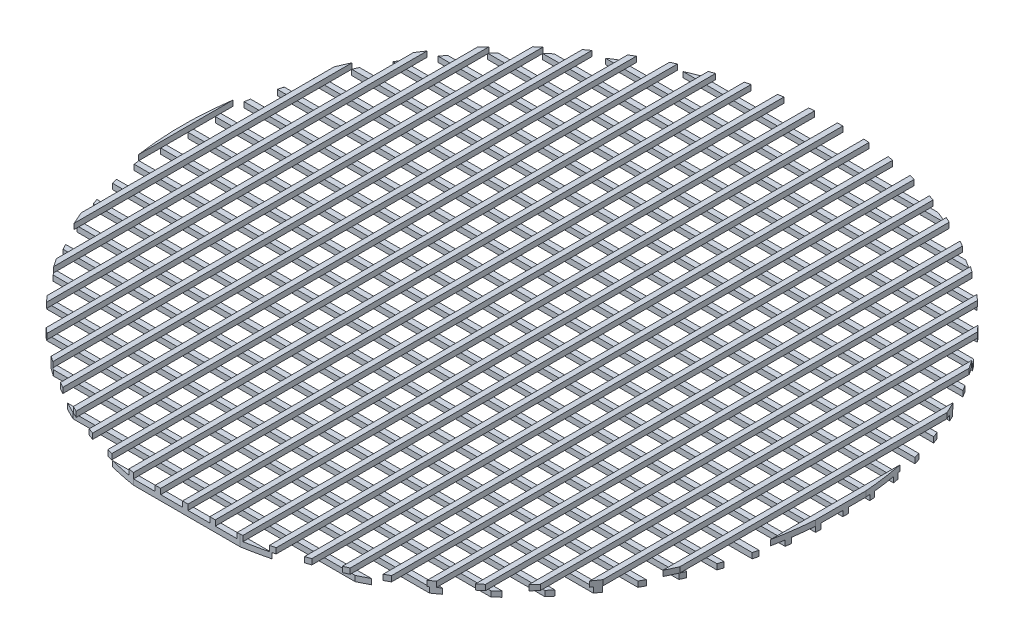
from build123d import *

# Parameters (mm, degrees)
SKETCH1_W              = 0.1
SKETCH1_H              = 12
BOSS_EXTRUDE2_DEPTH    = 0.1
BOSS_EXTRUDE2_2_DEPTH  = 0.1
BOSS_EXTRUDE2_3_DEPTH  = 0.1
BOSS_EXTRUDE2_4_DEPTH  = 0.1
BOSS_EXTRUDE2_5_DEPTH  = 0.1
BOSS_EXTRUDE2_6_DEPTH  = 0.1
BOSS_EXTRUDE2_7_DEPTH  = 0.1
BOSS_EXTRUDE2_8_DEPTH  = 0.1
BOSS_EXTRUDE2_9_DEPTH  = 0.1
BOSS_EXTRUDE2_10_DEPTH = 0.1
BOSS_EXTRUDE2_11_DEPTH = 0.1
BOSS_EXTRUDE2_12_DEPTH = 0.1
BOSS_EXTRUDE2_13_DEPTH = 0.1
BOSS_EXTRUDE2_14_DEPTH = 0.1
BOSS_EXTRUDE2_15_DEPTH = 0.1
BOSS_EXTRUDE2_16_DEPTH = 0.1
BOSS_EXTRUDE2_17_DEPTH = 0.1
BOSS_EXTRUDE2_18_DEPTH = 0.1
BOSS_EXTRUDE2_19_DEPTH = 0.1
BOSS_EXTRUDE2_20_DEPTH = 0.1
BOSS_EXTRUDE2_21_DEPTH = 0.1
BOSS_EXTRUDE2_22_DEPTH = 0.1
BOSS_EXTRUDE2_23_DEPTH = 0.1
BOSS_EXTRUDE2_24_DEPTH = 0.1
BOSS_EXTRUDE2_25_DEPTH = 0.1
SKETCH3_W              = 12
SKETCH3_H              = 0.1
BOSS_EXTRUDE5_DEPTH    = 0.1
SKETCH4_OUTSIDE_W      = 17.522
SKETCH4_OUTSIDE_H      = 17.522
SKETCH4_OUTSIDE_R      = 6.039831041
CUT_EXTRUDE2_DEPTH     = 53.029315831
SKETCH4_2_OUTSIDE_W    = 17.508
SKETCH4_2_OUTSIDE_H    = 17.408
SKETCH4_2_OUTSIDE_R    = 6.039831041
CUT_EXTRUDE4_DEPTH     = 52.966682012


with BuildPart() as part:
    # Sketch1 → Boss-Extrude2 (new body)
    with BuildSketch(Plane(origin=(0, 0, 0), x_dir=(1, 0, 0), z_dir=(0, 1, 0))):
        with Locations((-33.984973502, 26.518332714)):
            Rectangle(SKETCH1_W, SKETCH1_H)
    extrude(amount=BOSS_EXTRUDE2_DEPTH)


with BuildPart() as body_2:
    # Sketch1 → Boss-Extrude2 2 (new body)
    with BuildSketch(Plane(origin=(0, 0, 0), x_dir=(1, 0, 0), z_dir=(0, 1, 0))):
        with Locations((-34.484973502, 26.518332714)):
            Rectangle(SKETCH1_W, SKETCH1_H)
    extrude(amount=BOSS_EXTRUDE2_2_DEPTH)


    add(part.part)  # Boss-Extrude5 merges part


with BuildPart() as body_3:
    # Sketch1 → Boss-Extrude2 3 (new body)
    with BuildSketch(Plane(origin=(0, 0, 0), x_dir=(1, 0, 0), z_dir=(0, 1, 0))):
        with Locations((-33.484973502, 26.518332714)):
            Rectangle(SKETCH1_W, SKETCH1_H)
    extrude(amount=BOSS_EXTRUDE2_3_DEPTH)


with BuildPart() as body_4:
    # Sketch1 → Boss-Extrude2 4 (new body)
    with BuildSketch(Plane(origin=(0, 0, 0), x_dir=(1, 0, 0), z_dir=(0, 1, 0))):
        with Locations((-32.984973502, 26.518332714)):
            Rectangle(SKETCH1_W, SKETCH1_H)
    extrude(amount=BOSS_EXTRUDE2_4_DEPTH)


with BuildPart() as body_5:
    # Sketch1 → Boss-Extrude2 5 (new body)
    with BuildSketch(Plane(origin=(0, 0, 0), x_dir=(1, 0, 0), z_dir=(0, 1, 0))):
        with Locations((-32.484973502, 26.518332714)):
            Rectangle(SKETCH1_W, SKETCH1_H)
    extrude(amount=BOSS_EXTRUDE2_5_DEPTH)


with BuildPart() as body_6:
    # Sketch1 → Boss-Extrude2 6 (new body)
    with BuildSketch(Plane(origin=(0, 0, 0), x_dir=(1, 0, 0), z_dir=(0, 1, 0))):
        with Locations((-31.984973502, 26.518332714)):
            Rectangle(SKETCH1_W, SKETCH1_H)
    extrude(amount=BOSS_EXTRUDE2_6_DEPTH)


with BuildPart() as body_7:
    # Sketch1 → Boss-Extrude2 7 (new body)
    with BuildSketch(Plane(origin=(0, 0, 0), x_dir=(1, 0, 0), z_dir=(0, 1, 0))):
        with Locations((-31.484973502, 26.518332714)):
            Rectangle(SKETCH1_W, SKETCH1_H)
    extrude(amount=BOSS_EXTRUDE2_7_DEPTH)


with BuildPart() as body_8:
    # Sketch1 → Boss-Extrude2 8 (new body)
    with BuildSketch(Plane(origin=(0, 0, 0), x_dir=(1, 0, 0), z_dir=(0, 1, 0))):
        with Locations((-30.984973502, 26.518332714)):
            Rectangle(SKETCH1_W, SKETCH1_H)
    extrude(amount=BOSS_EXTRUDE2_8_DEPTH)


with BuildPart() as body_9:
    # Sketch1 → Boss-Extrude2 9 (new body)
    with BuildSketch(Plane(origin=(0, 0, 0), x_dir=(1, 0, 0), z_dir=(0, 1, 0))):
        with Locations((-30.484973502, 26.518332714)):
            Rectangle(SKETCH1_W, SKETCH1_H)
    extrude(amount=BOSS_EXTRUDE2_9_DEPTH)


with BuildPart() as body_10:
    # Sketch1 → Boss-Extrude2 10 (new body)
    with BuildSketch(Plane(origin=(0, 0, 0), x_dir=(1, 0, 0), z_dir=(0, 1, 0))):
        with Locations((-29.984973502, 26.518332714)):
            Rectangle(SKETCH1_W, SKETCH1_H)
    extrude(amount=BOSS_EXTRUDE2_10_DEPTH)


with BuildPart() as body_11:
    # Sketch1 → Boss-Extrude2 11 (new body)
    with BuildSketch(Plane(origin=(0, 0, 0), x_dir=(1, 0, 0), z_dir=(0, 1, 0))):
        with Locations((-29.484973502, 26.518332714)):
            Rectangle(SKETCH1_W, SKETCH1_H)
    extrude(amount=BOSS_EXTRUDE2_11_DEPTH)


with BuildPart() as body_12:
    # Sketch1 → Boss-Extrude2 12 (new body)
    with BuildSketch(Plane(origin=(0, 0, 0), x_dir=(1, 0, 0), z_dir=(0, 1, 0))):
        with Locations((-28.984973502, 26.518332714)):
            Rectangle(SKETCH1_W, SKETCH1_H)
    extrude(amount=BOSS_EXTRUDE2_12_DEPTH)


with BuildPart() as body_13:
    # Sketch1 → Boss-Extrude2 13 (new body)
    with BuildSketch(Plane(origin=(0, 0, 0), x_dir=(1, 0, 0), z_dir=(0, 1, 0))):
        with Locations((-28.484973502, 26.518332714)):
            Rectangle(SKETCH1_W, SKETCH1_H)
    extrude(amount=BOSS_EXTRUDE2_13_DEPTH)


with BuildPart() as body_14:
    # Sketch1 → Boss-Extrude2 14 (new body)
    with BuildSketch(Plane(origin=(0, 0, 0), x_dir=(1, 0, 0), z_dir=(0, 1, 0))):
        with Locations((-34.984973502, 26.518332714)):
            Rectangle(SKETCH1_W, SKETCH1_H)
    extrude(amount=BOSS_EXTRUDE2_14_DEPTH)


with BuildPart() as body_15:
    # Sketch1 → Boss-Extrude2 15 (new body)
    with BuildSketch(Plane(origin=(0, 0, 0), x_dir=(1, 0, 0), z_dir=(0, 1, 0))):
        with Locations((-35.484973502, 26.518332714)):
            Rectangle(SKETCH1_W, SKETCH1_H)
    extrude(amount=BOSS_EXTRUDE2_15_DEPTH)


with BuildPart() as body_16:
    # Sketch1 → Boss-Extrude2 16 (new body)
    with BuildSketch(Plane(origin=(0, 0, 0), x_dir=(1, 0, 0), z_dir=(0, 1, 0))):
        with Locations((-35.984973502, 26.518332714)):
            Rectangle(SKETCH1_W, SKETCH1_H)
    extrude(amount=BOSS_EXTRUDE2_16_DEPTH)


with BuildPart() as body_17:
    # Sketch1 → Boss-Extrude2 17 (new body)
    with BuildSketch(Plane(origin=(0, 0, 0), x_dir=(1, 0, 0), z_dir=(0, 1, 0))):
        with Locations((-36.484973502, 26.518332714)):
            Rectangle(SKETCH1_W, SKETCH1_H)
    extrude(amount=BOSS_EXTRUDE2_17_DEPTH)


with BuildPart() as body_18:
    # Sketch1 → Boss-Extrude2 18 (new body)
    with BuildSketch(Plane(origin=(0, 0, 0), x_dir=(1, 0, 0), z_dir=(0, 1, 0))):
        with Locations((-36.984973502, 26.518332714)):
            Rectangle(SKETCH1_W, SKETCH1_H)
    extrude(amount=BOSS_EXTRUDE2_18_DEPTH)


with BuildPart() as body_19:
    # Sketch1 → Boss-Extrude2 19 (new body)
    with BuildSketch(Plane(origin=(0, 0, 0), x_dir=(1, 0, 0), z_dir=(0, 1, 0))):
        with Locations((-37.484973502, 26.518332714)):
            Rectangle(SKETCH1_W, SKETCH1_H)
    extrude(amount=BOSS_EXTRUDE2_19_DEPTH)


with BuildPart() as body_20:
    # Sketch1 → Boss-Extrude2 20 (new body)
    with BuildSketch(Plane(origin=(0, 0, 0), x_dir=(1, 0, 0), z_dir=(0, 1, 0))):
        with Locations((-37.984973502, 26.518332714)):
            Rectangle(SKETCH1_W, SKETCH1_H)
    extrude(amount=BOSS_EXTRUDE2_20_DEPTH)


with BuildPart() as body_21:
    # Sketch1 → Boss-Extrude2 21 (new body)
    with BuildSketch(Plane(origin=(0, 0, 0), x_dir=(1, 0, 0), z_dir=(0, 1, 0))):
        with Locations((-38.484973502, 26.518332714)):
            Rectangle(SKETCH1_W, SKETCH1_H)
    extrude(amount=BOSS_EXTRUDE2_21_DEPTH)


with BuildPart() as body_22:
    # Sketch1 → Boss-Extrude2 22 (new body)
    with BuildSketch(Plane(origin=(0, 0, 0), x_dir=(1, 0, 0), z_dir=(0, 1, 0))):
        with Locations((-38.984973502, 26.518332714)):
            Rectangle(SKETCH1_W, SKETCH1_H)
    extrude(amount=BOSS_EXTRUDE2_22_DEPTH)


with BuildPart() as body_23:
    # Sketch1 → Boss-Extrude2 23 (new body)
    with BuildSketch(Plane(origin=(0, 0, 0), x_dir=(1, 0, 0), z_dir=(0, 1, 0))):
        with Locations((-39.484973502, 26.518332714)):
            Rectangle(SKETCH1_W, SKETCH1_H)
    extrude(amount=BOSS_EXTRUDE2_23_DEPTH)


with BuildPart() as body_24:
    # Sketch1 → Boss-Extrude2 24 (new body)
    with BuildSketch(Plane(origin=(0, 0, 0), x_dir=(1, 0, 0), z_dir=(0, 1, 0))):
        with Locations((-39.984973502, 26.518332714)):
            Rectangle(SKETCH1_W, SKETCH1_H)
    extrude(amount=BOSS_EXTRUDE2_24_DEPTH)


with BuildPart() as body_25:
    # Sketch1 → Boss-Extrude2 25 (new body)
    with BuildSketch(Plane(origin=(0, 0, 0), x_dir=(1, 0, 0), z_dir=(0, 1, 0))):
        with Locations((-40.484973502, 26.518332714)):
            Rectangle(SKETCH1_W, SKETCH1_H)
    extrude(amount=BOSS_EXTRUDE2_25_DEPTH)


with BuildPart() as body_2_1:
    add(body_2.part)

    add(body_3.part)  # Boss-Extrude5 merges body 3

    add(body_4.part)  # Boss-Extrude5 merges body 4

    add(body_5.part)  # Boss-Extrude5 merges body 5

    add(body_6.part)  # Boss-Extrude5 merges body 6

    add(body_7.part)  # Boss-Extrude5 merges body 7

    add(body_8.part)  # Boss-Extrude5 merges body 8

    add(body_9.part)  # Boss-Extrude5 merges body 9

    add(body_10.part)  # Boss-Extrude5 merges body 10

    add(body_11.part)  # Boss-Extrude5 merges body 11

    add(body_12.part)  # Boss-Extrude5 merges body 12

    add(body_13.part)  # Boss-Extrude5 merges body 13

    add(body_14.part)  # Boss-Extrude5 merges body 14

    add(body_15.part)  # Boss-Extrude5 merges body 15

    add(body_16.part)  # Boss-Extrude5 merges body 16

    add(body_17.part)  # Boss-Extrude5 merges body 17

    add(body_18.part)  # Boss-Extrude5 merges body 18

    add(body_19.part)  # Boss-Extrude5 merges body 19

    add(body_20.part)  # Boss-Extrude5 merges body 20

    add(body_21.part)  # Boss-Extrude5 merges body 21

    add(body_22.part)  # Boss-Extrude5 merges body 22

    add(body_23.part)  # Boss-Extrude5 merges body 23

    add(body_24.part)  # Boss-Extrude5 merges body 24
    # Sketch3 → Boss-Extrude5 (add)
    with BuildSketch(Plane(origin=(0, 0, 0), x_dir=(1, 0, 0), z_dir=(0, 1, 0))):
        with Locations((-34.434973502, 21.068332714)):
            Rectangle(SKETCH3_W, SKETCH3_H)
        with Locations((-34.434973502, 20.568332714)):
            Rectangle(SKETCH3_W, SKETCH3_H)
        with Locations((-34.434973502, 21.568332714)):
            Rectangle(SKETCH3_W, SKETCH3_H)
        with Locations((-34.434973502, 22.068332714)):
            Rectangle(SKETCH3_W, SKETCH3_H)
        with Locations((-34.434973502, 22.568332714)):
            Rectangle(SKETCH3_W, SKETCH3_H)
        with Locations((-34.434973502, 23.068332714)):
            Rectangle(SKETCH3_W, SKETCH3_H)
        with Locations((-34.434973502, 23.568332714)):
            Rectangle(SKETCH3_W, SKETCH3_H)
        with Locations((-34.434973502, 24.068332714)):
            Rectangle(SKETCH3_W, SKETCH3_H)
        with Locations((-34.434973502, 24.568332714)):
            Rectangle(SKETCH3_W, SKETCH3_H)
        with Locations((-34.434973502, 25.068332714)):
            Rectangle(SKETCH3_W, SKETCH3_H)
        with Locations((-34.434973502, 25.568332714)):
            Rectangle(SKETCH3_W, SKETCH3_H)
        with Locations((-34.434973502, 26.068332714)):
            Rectangle(SKETCH3_W, SKETCH3_H)
        with Locations((-34.434973502, 26.568332714)):
            Rectangle(SKETCH3_W, SKETCH3_H)
        with Locations((-34.434973502, 27.068332714)):
            Rectangle(SKETCH3_W, SKETCH3_H)
        with Locations((-34.434973502, 27.568332714)):
            Rectangle(SKETCH3_W, SKETCH3_H)
        with Locations((-34.434973502, 28.068332714)):
            Rectangle(SKETCH3_W, SKETCH3_H)
        with Locations((-34.434973502, 28.568332714)):
            Rectangle(SKETCH3_W, SKETCH3_H)
        with Locations((-34.434973502, 29.068332714)):
            Rectangle(SKETCH3_W, SKETCH3_H)
        with Locations((-34.434973502, 29.568332714)):
            Rectangle(SKETCH3_W, SKETCH3_H)
        with Locations((-34.434973502, 30.068332714)):
            Rectangle(SKETCH3_W, SKETCH3_H)
        with Locations((-34.434973502, 30.568332714)):
            Rectangle(SKETCH3_W, SKETCH3_H)
        with Locations((-34.434973502, 31.068332714)):
            Rectangle(SKETCH3_W, SKETCH3_H)
        with Locations((-34.434973502, 31.568332714)):
            Rectangle(SKETCH3_W, SKETCH3_H)
        with Locations((-34.434973502, 32.068332714)):
            Rectangle(SKETCH3_W, SKETCH3_H)
        with Locations((-34.434973502, 32.568332714)):
            Rectangle(SKETCH3_W, SKETCH3_H)
    extrude(amount=-BOSS_EXTRUDE5_DEPTH)

    # Sketch4 outside → Cut-Extrude2 (cut, through all)
    with BuildSketch(Plane(origin=(0, 0, 0), x_dir=(1, 0, 0), z_dir=(0, 1, 0))):
        with Locations((-34.485, 26.568)):
            Rectangle(SKETCH4_OUTSIDE_W, SKETCH4_OUTSIDE_H)
        with Locations((-34.457249113, 26.478501673)):
            Circle(SKETCH4_OUTSIDE_R, mode=Mode.SUBTRACT)
    extrude(amount=-CUT_EXTRUDE2_DEPTH, mode=Mode.SUBTRACT)


with BuildPart() as cut_extrude4_tool:
    # Sketch4<2> outside → Cut-Extrude4 (new, through all)
    with BuildSketch(Plane(origin=(0, 0, 0), x_dir=(1, 0, 0), z_dir=(0, 1, 0))):
        with Locations((-34.485, 26.518)):
            Rectangle(SKETCH4_2_OUTSIDE_W, SKETCH4_2_OUTSIDE_H)
        with Locations((-34.457249113, 26.478501673)):
            Circle(SKETCH4_2_OUTSIDE_R, mode=Mode.SUBTRACT)
    extrude(amount=CUT_EXTRUDE4_DEPTH)


with BuildPart() as body_2_2:
    add(body_2_1.part)

    # Cut-Extrude4: cut by cut_extrude4_tool
    add(cut_extrude4_tool.part, mode=Mode.SUBTRACT)


with BuildPart() as body_25_1:
    add(body_25.part)

    # Cut-Extrude4: cut by cut_extrude4_tool
    add(cut_extrude4_tool.part, mode=Mode.SUBTRACT)


solid = Compound([body_2_2.part, body_25_1.part])
